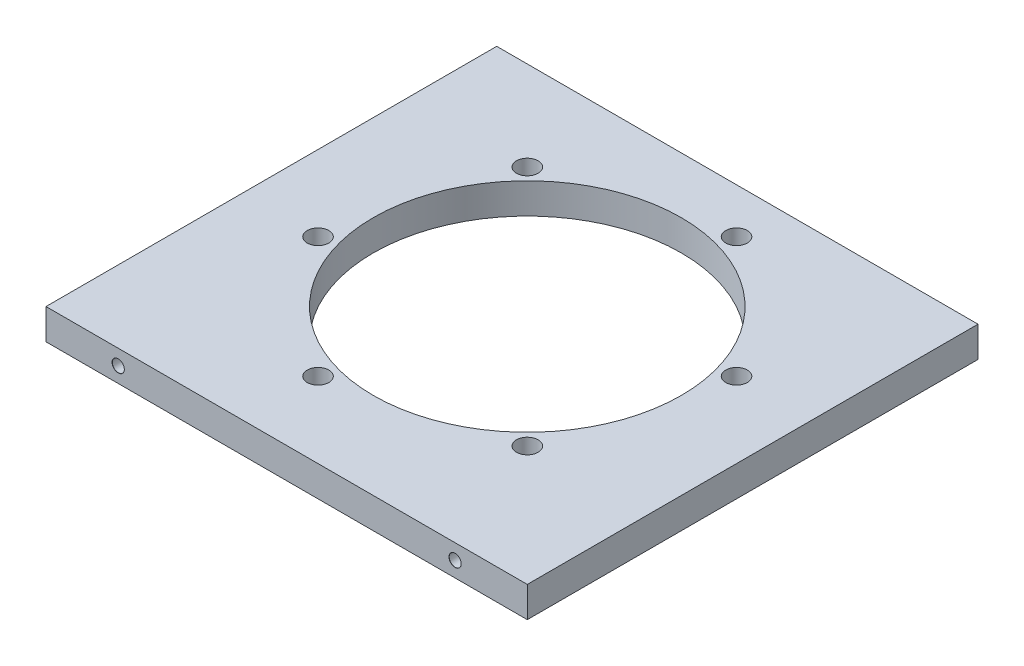
from build123d import *

# Parameters (mm, degrees)
SKETCH1_W                             = 100
SKETCH1_H                             = 100
SKETCH1_R                             = 32
BOSS_EXTRUDE3_DEPTH                   = 6.35
M4_CLEARANCE_HOLE2_D                  = 4.5
M4_CLEARANCE_HOLE2_CSINK_D            = 4.55
M4_CLEARANCE_HOLE2_CSINK_ANGLE        = 90
TAP_DRILL_FOR_M3X0_5_TAP2_D           = 2.5
TAP_DRILL_FOR_M3X0_5_TAP2_DEPTH       = 9.248924226
TAP_DRILL_FOR_M3X0_5_TAP2_CSINK_D     = 2.55
TAP_DRILL_FOR_M3X0_5_TAP2_CSINK_ANGLE = 90
TAP_DRILL_FOR_M3X0_5_TAP2_TIP         = 0.751075774
SKETCH32_W                            = 100
SKETCH32_H                            = 6.35
CUT_EXTRUDE1_DEPTH                    = 10
TAP_DRILL_FOR_M3X0_5_TAP4_D           = 2.5
TAP_DRILL_FOR_M3X0_5_TAP4_DEPTH       = 9.248924226
TAP_DRILL_FOR_M3X0_5_TAP4_CSINK_D     = 2.55
TAP_DRILL_FOR_M3X0_5_TAP4_CSINK_ANGLE = 90
TAP_DRILL_FOR_M3X0_5_TAP4_TIP         = 0.751075774


with BuildPart() as part:
    # Sketch1 → Boss-Extrude3 (new body)
    with BuildSketch(Plane(origin=(0, 0, 0), x_dir=(1, 0, 0), z_dir=(0, 1, 0))):
        Rectangle(SKETCH1_W, SKETCH1_H)
        Circle(SKETCH1_R, mode=Mode.SUBTRACT)
    extrude(amount=BOSS_EXTRUDE3_DEPTH)

    # M4 Clearance Hole2 (through all)
    with Locations(Plane(origin=(0, 0, 0), x_dir=(-1, 0, 0), z_dir=(0, -1, 0))):
        with Locations((-9.188076101, 34.290366833), (25.102290732, 25.102290732), (34.290366833, -9.188076101), (9.188076101, -34.290366833), (-25.102290732, -25.102290732), (-34.290366833, 9.188076101)):
            CounterSinkHole(M4_CLEARANCE_HOLE2_D / 2, M4_CLEARANCE_HOLE2_CSINK_D / 2, counter_sink_angle=M4_CLEARANCE_HOLE2_CSINK_ANGLE)

    # Tap Drill for M3x0.5 Tap2
    with Locations(Plane.XY.offset(50)):
        with Locations((-35, 3.175), (35, 3.175)):
            CounterSinkHole(TAP_DRILL_FOR_M3X0_5_TAP2_D / 2, TAP_DRILL_FOR_M3X0_5_TAP2_CSINK_D / 2, depth=TAP_DRILL_FOR_M3X0_5_TAP2_DEPTH, counter_sink_angle=TAP_DRILL_FOR_M3X0_5_TAP2_CSINK_ANGLE)
            with Locations((0, 0, -(TAP_DRILL_FOR_M3X0_5_TAP2_DEPTH + TAP_DRILL_FOR_M3X0_5_TAP2_TIP / 2))):  # 118° drill point
                Cone(0, TAP_DRILL_FOR_M3X0_5_TAP2_D / 2, TAP_DRILL_FOR_M3X0_5_TAP2_TIP, mode=Mode.SUBTRACT)

    # Sketch32 → Cut-Extrude1 (cut)
    with BuildSketch(Plane(origin=(0, 6.35, 0), x_dir=(1, 0, 0), z_dir=(0, 1, 0))):
        with Locations((0, 46.825)):
            Rectangle(SKETCH32_W, SKETCH32_H)
    extrude(amount=-CUT_EXTRUDE1_DEPTH, mode=Mode.SUBTRACT)

    # Tap Drill for M3x0.5 Tap4
    with Locations(Plane(origin=(0, 0, -43.65), x_dir=(-1, 0, 0), z_dir=(0, 0, -1))):
        with Locations((-35, 3.175), (35, 3.175)):
            CounterSinkHole(TAP_DRILL_FOR_M3X0_5_TAP4_D / 2, TAP_DRILL_FOR_M3X0_5_TAP4_CSINK_D / 2, depth=TAP_DRILL_FOR_M3X0_5_TAP4_DEPTH, counter_sink_angle=TAP_DRILL_FOR_M3X0_5_TAP4_CSINK_ANGLE)
            with Locations((0, 0, -(TAP_DRILL_FOR_M3X0_5_TAP4_DEPTH + TAP_DRILL_FOR_M3X0_5_TAP4_TIP / 2))):  # 118° drill point
                Cone(0, TAP_DRILL_FOR_M3X0_5_TAP4_D / 2, TAP_DRILL_FOR_M3X0_5_TAP4_TIP, mode=Mode.SUBTRACT)


solid = part.part
